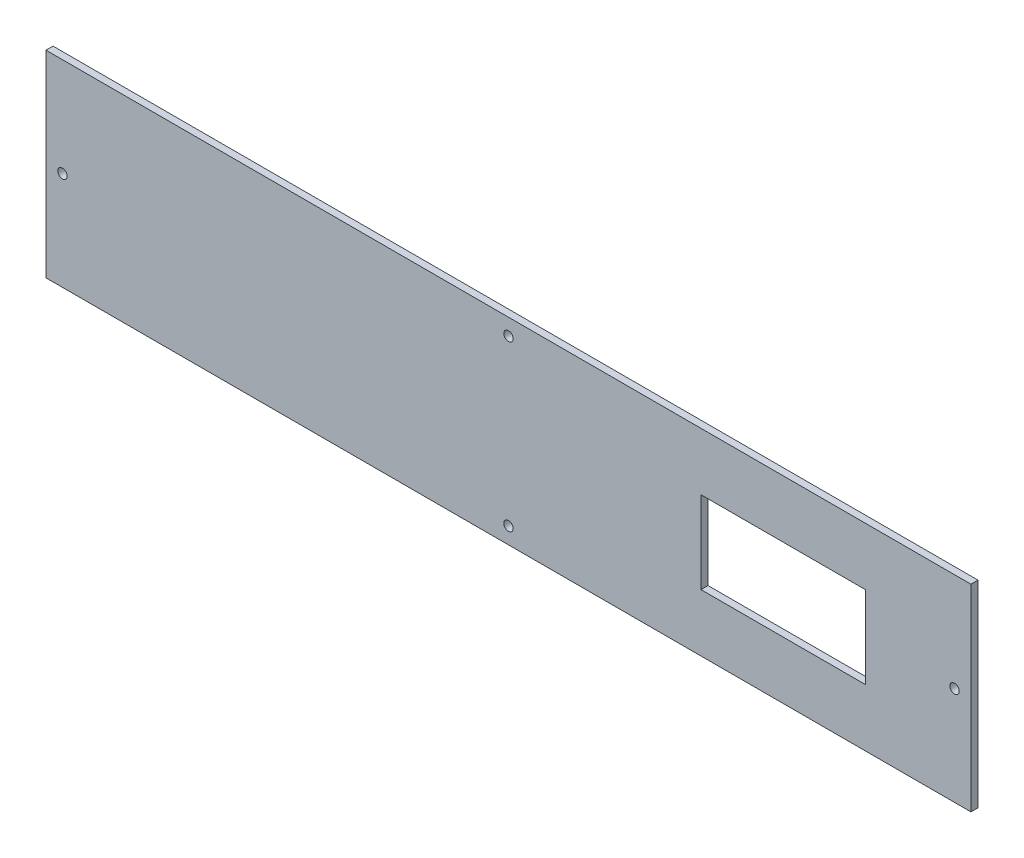
from build123d import *

# Parameters (mm, degrees)
SKETCH_F_W                   = 394
SKETCH_F_H                   = 84
SKETCH_F_R                   = 2
SKETCH_F_W_2                 = 70
SKETCH_F_H_2                 = 35
ESTRUSIONE_ESTRUSIONE1_DEPTH = 3


with BuildPart() as part:
    # Sketch f → Estrusione-Estrusione1 (new body)
    with BuildSketch(Plane.XY):
        with Locations((197, 42)):
            Rectangle(SKETCH_F_W, SKETCH_F_H)
        with Locations((7, 42)):
            Circle(SKETCH_F_R, mode=Mode.SUBTRACT)
        with Locations((197, 77)):
            Circle(SKETCH_F_R, mode=Mode.SUBTRACT)
        with Locations((197, 7)):
            Circle(SKETCH_F_R, mode=Mode.SUBTRACT)
        with Locations((387, 42)):
            Circle(SKETCH_F_R, mode=Mode.SUBTRACT)
        with Locations((314, 42)):
            Rectangle(SKETCH_F_W_2, SKETCH_F_H_2, mode=Mode.SUBTRACT)
    extrude(amount=ESTRUSIONE_ESTRUSIONE1_DEPTH)


solid = part.part
